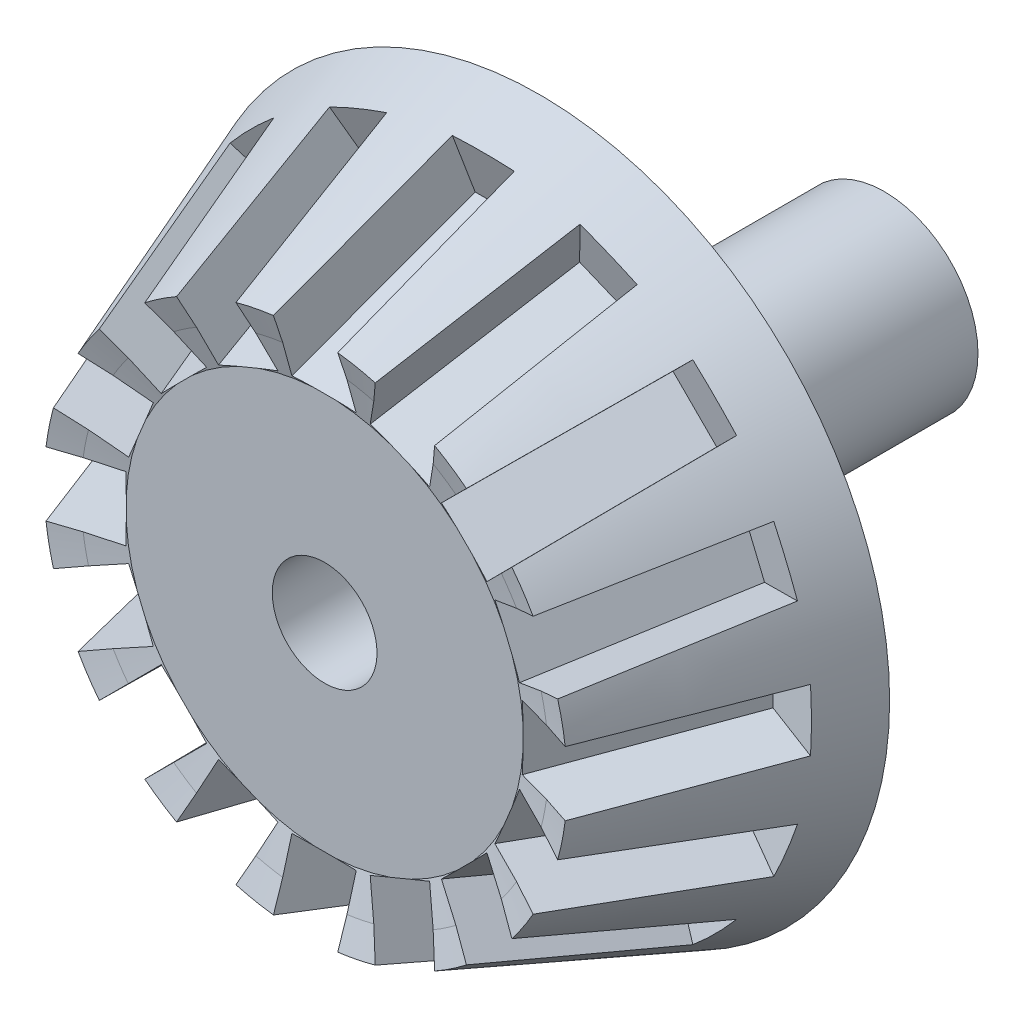
from build123d import *

# Parameters (mm, degrees)
CUT_EXTRUDE2_DEPTH      = 2.54
CIRPATTERN2_COUNT       = 16
CUT_EXTRUDE3_DEPTH      = 2.54
SKETCH3_R               = 3.6068
SKETCH3_R_2             = 2.0193
BOSS_EXTRUDE1_DEPTH     = 12.7
CUT_EXTRUDE4_DEPTH      = 23.930228957
CUT_EXTRUDE4_DEPTH_BACK = 23.930228957
SKETCH4_R               = 2.0193


with BuildPart() as part:
    # Sketch1 → Revolve1 (revolve)
    with BuildSketch(Plane(origin=(0, 0, 0), x_dir=(0, 0, -1), z_dir=(1, 0, 0))):
        Polygon((35.74584477, 13.5001), (26.716343661, 10.089936701), (27.072377446, 9.021527747), (27.451258295, 7.664529033), (27.451258295, 0), (36.347529265, 0), (36.347529265, 10.148412518), align=None)
    revolve1 = revolve(axis=Axis((0, 0, 0), (0, 0, -1)))

    # Sketch2 → Cut-Extrude2 (cut)
    with BuildSketch(Plane(origin=(0, 0, 0), x_dir=(0.9999999999999953, 9.130068833235357e-08, 3.448144617935982e-08), z_dir=(-9.759500919914732e-08, 0.9355057095803914, 0.35331157261329427))):
        Polygon((1.244598979, 27.709196061), (1.193798678, 35.86698027), (-1.322e-06, 35.86698027), (-1.193801322, 35.866980182), (-1.244601021, 27.709195969), (-1.021e-06, 27.709196061), align=None)
    cut_extrude2 = extrude(amount=-CUT_EXTRUDE2_DEPTH, mode=Mode.SUBTRACT)


with BuildPart() as cut_extrude2_kept_piece:
    # of the separate pieces the step leaves, the one the design keeps (cut_extrude2_pieces_kept)
    add(part.part.solids().sort_by_distance((0, 13.5001, -35.74584477))[0])

    # CirPattern2: Revolve1, Cut-Extrude2 ×16 about axis
    cirpattern2_axis = Axis((0, 0, -27.072377446), (0, 0, 1))
    add([revolve1.rotate(cirpattern2_axis, i * 360 / CIRPATTERN2_COUNT) for i in range(1, CIRPATTERN2_COUNT)])
    add([cut_extrude2.rotate(cirpattern2_axis, i * 360 / CIRPATTERN2_COUNT) for i in range(1, CIRPATTERN2_COUNT)], mode=Mode.SUBTRACT)

    # Sketch2<4> → Cut-Extrude3 (cut)
    with BuildSketch(Plane(origin=(0, 0, 0), x_dir=(0.9999999999999953, 9.130068833235357e-08, 3.448144617935982e-08), z_dir=(-9.759500919914732e-08, 0.9355057095803914, 0.35331157261329427))):
        Polygon((1.244598979, 27.709196061), (1.193798678, 35.86698027), (-1.322e-06, 35.86698027), (-1.193801322, 35.866980182), (-1.244601021, 27.709195969), (-1.021e-06, 27.709196061), align=None)
    extrude(amount=-CUT_EXTRUDE3_DEPTH, mode=Mode.SUBTRACT)

    # Sketch3 → Boss-Extrude1 (add)
    with BuildSketch(Plane(origin=(0, 0, -36.347529265), x_dir=(-1, 0, 0), z_dir=(0, 0, -1))):
        Circle(SKETCH3_R)
        Circle(SKETCH3_R_2, mode=Mode.SUBTRACT)
    extrude(amount=BOSS_EXTRUDE1_DEPTH)

    # Sketch4 → Cut-Extrude4 (cut, two sides: drawn at the far end of the back side and taken through both)
    with BuildSketch(Plane(origin=(0, 0, -36.347529265), x_dir=(-1, 0, 0), z_dir=(0, 0, -1)).offset(-CUT_EXTRUDE4_DEPTH_BACK)):
        Circle(SKETCH4_R)
    extrude(amount=CUT_EXTRUDE4_DEPTH + CUT_EXTRUDE4_DEPTH_BACK, mode=Mode.SUBTRACT)


solid = cut_extrude2_kept_piece.part
